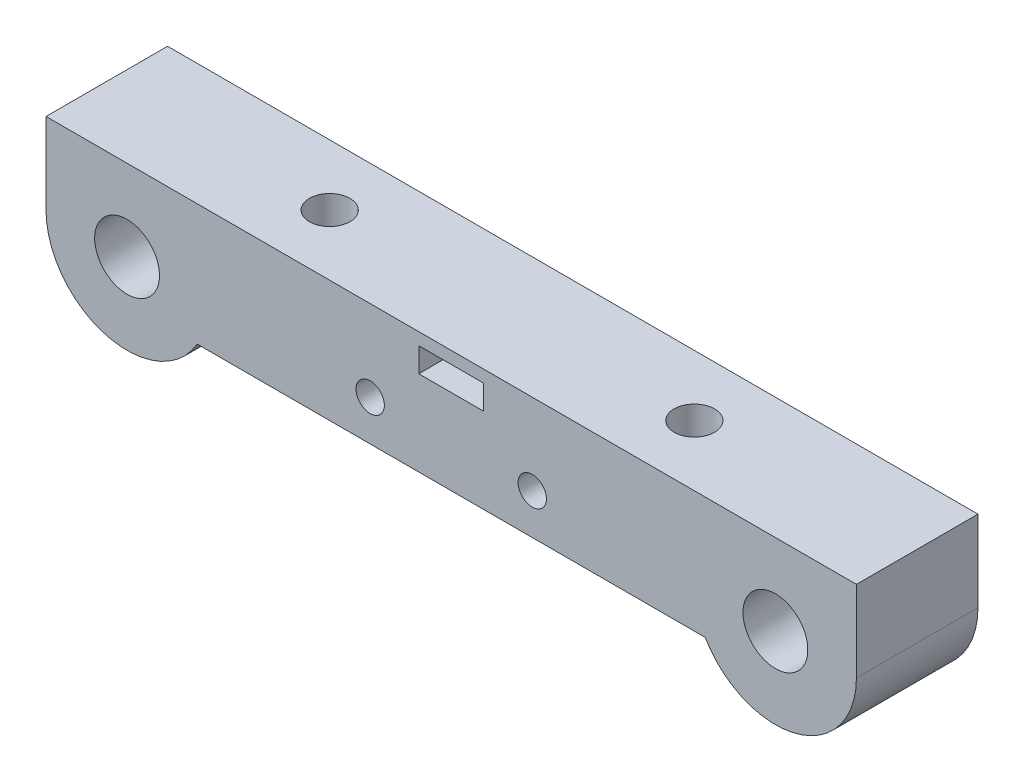
from build123d import *

# Parameters (mm, degrees)
ESBO_O1_R                = 4
ESBO_O1_R_2              = 1.75
ESBO_O1_W                = 8
ESBO_O1_H                = 3
RESSALTO_EXTRUS_O1_DEPTH = 15
ESBO_O2_R                = 2.5
CORTE_EXTRUS_O1_DEPTH    = 15


with BuildPart() as part:
    # Esboço1 → Ressalto-extrusão1 (new body)
    with BuildSketch(Plane.XY):
        with BuildLine():
            Line((50, 0), (50, -10))
            ThreePointArc((50, -10), (42.588190451, -19.659258263), (31.339745962, -15))
            Line((31.339745962, -15), (-31.339745962, -15))
            ThreePointArc((-31.339745962, -15), (-42.588190451, -19.659258263), (-50, -10))
            Line((-50, -10), (-50, 0))
            Line((-50, 0), (50, 0))
        make_face()
        with Locations((-40, -10)):
            Circle(ESBO_O1_R, mode=Mode.SUBTRACT)
        with Locations((40, -10)):
            Circle(ESBO_O1_R, mode=Mode.SUBTRACT)
        with Locations((10, -10)):
            Circle(ESBO_O1_R_2, mode=Mode.SUBTRACT)
        with Locations((-10, -10)):
            Circle(ESBO_O1_R_2, mode=Mode.SUBTRACT)
        with Locations((0, -3)):
            Rectangle(ESBO_O1_W, ESBO_O1_H, mode=Mode.SUBTRACT)
    extrude(amount=RESSALTO_EXTRUS_O1_DEPTH)

    # Esboço2 → Corte-extrusão1 (cut)
    with BuildSketch(Plane.XZ.offset(15)):
        with Locations((-22.5, 7.5)):
            Circle(ESBO_O2_R)
        with Locations((22.5, 7.5)):
            Circle(ESBO_O2_R)
    extrude(amount=-CORTE_EXTRUS_O1_DEPTH, mode=Mode.SUBTRACT)


solid = part.part
